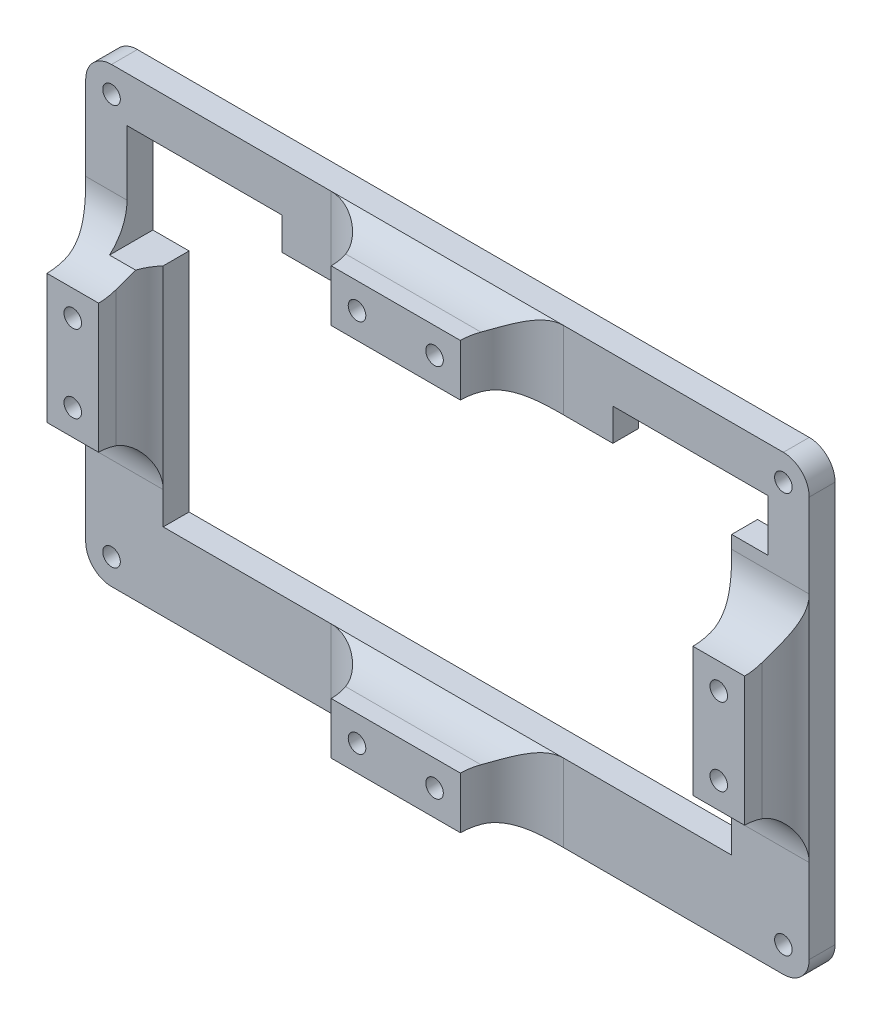
from build123d import *

# Parameters (mm, degrees)
SKETCH1_W            = 140
SKETCH1_H            = 87.5
SKETCH1_W_2          = 110
SKETCH1_H_2          = 57.5
BOSS_EXTRUDE1_DEPTH  = 5
M3_CLEARANCE_HOLE1_D = 3.4
SKETCH5_W            = 30
SKETCH5_H            = 20
SKETCH5_H_2          = 10
CUT_EXTRUDE1_DEPTH   = 5
FILLET1_R            = 5
SKETCH6_W            = 25
SKETCH6_H            = 10
SKETCH6_W_2          = 10
SKETCH6_H_2          = 25
BOSS_EXTRUDE2_DEPTH  = 10
SKETCH7_R            = 1.7
CUT_EXTRUDE2_DEPTH   = 84.899120973
SKETCH8_R            = 2.5
CUT_EXTRUDE3_DEPTH   = 10
FILLET2_R            = 10
FILLET3_START        = -70.000000131
FILLET3_DEPTH        = 15.000000131
FILLET3_2_DEPTH      = 8.000000131
FILLET3_START_2      = 12.5
FILLET3_3_DEPTH      = 10.5


with BuildPart() as part:
    # Sketch1 → Boss-Extrude1 (new body)
    with BuildSketch(Plane.XY):
        Rectangle(SKETCH1_W, SKETCH1_H)
        Rectangle(SKETCH1_W_2, SKETCH1_H_2, mode=Mode.SUBTRACT)
    extrude(amount=BOSS_EXTRUDE1_DEPTH)

    # M3 Clearance Hole1 (through all)
    with Locations(Plane.XY.offset(5)):
        with Locations((-65, 38.75), (65, 38.75), (65, -38.75), (-65, -38.75)):
            Hole(M3_CLEARANCE_HOLE1_D / 2)

    # Sketch5 → Cut-Extrude1 (cut)
    with BuildSketch(Plane.XY.offset(5)):
        with Locations((-47, 25)):
            Rectangle(SKETCH5_W, SKETCH5_H)
        with Locations((47, 30)):
            Rectangle(SKETCH5_W, SKETCH5_H_2)
    extrude(amount=-CUT_EXTRUDE1_DEPTH, mode=Mode.SUBTRACT)

    # Fillet1
    fillet1_edges = [part.edges().sort_by_distance(p)[0] for p in [
        (70, -43.75, 2.5),
        (-70, -43.75, 2.5),
        (-70, 43.75, 2.5),
        (70, 43.75, 2.5),
    ]]
    fillet(fillet1_edges, radius=FILLET1_R)

    # Sketch6 → Boss-Extrude2 (add)
    with BuildSketch(Plane.XY.offset(5)):
        with Locations((0, 36.25)):
            Rectangle(SKETCH6_W, SKETCH6_H)
        with Locations((62.5, 0)):
            Rectangle(SKETCH6_W_2, SKETCH6_H_2)
        with Locations((-62.5, 0)):
            Rectangle(SKETCH6_W_2, SKETCH6_H_2)
        with Locations((0, -36.25)):
            Rectangle(SKETCH6_W, SKETCH6_H)
    extrude(amount=BOSS_EXTRUDE2_DEPTH)

    # Sketch7 → Cut-Extrude2 (cut, through all)
    with BuildSketch(Plane(origin=(0, 0, 0), x_dir=(-1, 0, 0), z_dir=(0, 0, -1))):
        with Locations((-62.5, 7.5)):
            Circle(SKETCH7_R)
        with Locations((-62.5, -7.5)):
            Circle(SKETCH7_R)
        with Locations((7.5, 36.25)):
            Circle(SKETCH7_R)
        with Locations((-7.5, 36.25)):
            Circle(SKETCH7_R)
        with Locations((62.5, 7.5)):
            Circle(SKETCH7_R)
        with Locations((62.5, -7.5)):
            Circle(SKETCH7_R)
        with Locations((7.5, -36.25)):
            Circle(SKETCH7_R)
        with Locations((-7.5, -36.25)):
            Circle(SKETCH7_R)
    extrude(amount=-CUT_EXTRUDE2_DEPTH, mode=Mode.SUBTRACT)

    # Sketch8 → Cut-Extrude3 (cut)
    with BuildSketch(Plane(origin=(0, 0, 0), x_dir=(-1, 0, 0), z_dir=(0, 0, -1))):
        with Locations((7.5, 36.25)):
            Circle(SKETCH8_R)
        with Locations((-7.5, 36.25)):
            Circle(SKETCH8_R)
        with Locations((62.5, 7.5)):
            Circle(SKETCH8_R)
        with Locations((62.5, -7.5)):
            Circle(SKETCH8_R)
        with Locations((7.5, -36.25)):
            Circle(SKETCH8_R)
        with Locations((-7.5, -36.25)):
            Circle(SKETCH8_R)
        with Locations((-62.5, 7.5)):
            Circle(SKETCH8_R)
        with Locations((-62.5, -7.5)):
            Circle(SKETCH8_R)
    extrude(amount=-CUT_EXTRUDE3_DEPTH, mode=Mode.SUBTRACT)

    # Fillet2
    # the kernel refuses this fillet: 10 mm, written as the material it adds along each edge
    with BuildSketch(Plane(origin=(-57.5, -12.5, 5), x_dir=(1, 0, 0), z_dir=(0, 1, 0)), Plane(origin=(-67.5, 12.5, 5), x_dir=(-1, 0, 0), z_dir=(0, -1, 0)), Plane(origin=(57.5, 12.5, 5), x_dir=(-1, 0, 0), z_dir=(0, -1, 0)), Plane(origin=(67.5, -12.5, 5), x_dir=(1, 0, 0), z_dir=(0, 1, 0)), Plane(origin=(12.5, -31.25, 5), x_dir=(0, 1, 0), z_dir=(-1, 0, 0)), Plane(origin=(-12.5, -41.25, 5), x_dir=(0, -1, 0), z_dir=(1, 0, 0)), Plane(origin=(-12.5, 31.25, 5), x_dir=(0, -1, 0), z_dir=(1, 0, 0)), Plane(origin=(12.5, 41.25, 5), x_dir=(0, 1, 0), z_dir=(-1, 0, 0))) as fillet2_piece_1:
        with BuildLine():
            CenterArc((10, -6.614378278), FILLET2_R, 138.590377891, 41.409622109)
            Line((0, -6.614378278), (-0.2, -6.614378278))
            Line((-0.2, -6.614378278), (-0.2, 0))
            Line((-0.2, 0), (0, 0.2))
            ThreePointArc((0, 0.2), (1.25, 0.2), (2.35, 0.132287566))
            Line((2.35, 0.132287566), (2.5, 0))
        make_face()
    extrude(amount=25)
    with BuildSketch(Plane(origin=(-67.5, -12.5, 5), x_dir=(0, -1, 0), z_dir=(1, 0, 0)), Plane(origin=(67.5, 12.5, 5), x_dir=(0, 1, 0), z_dir=(-1, 0, 0)), Plane(origin=(57.5, -12.5, 5), x_dir=(0, -1, 0), z_dir=(1, 0, 0)), Plane(origin=(12.5, -41.25, 5), x_dir=(1, 0, 0), z_dir=(0, 1, 0)), Plane(origin=(-12.5, -31.25, 5), x_dir=(-1, 0, 0), z_dir=(0, -1, 0)), Plane(origin=(-12.5, 41.25, 5), x_dir=(-1, 0, 0), z_dir=(0, -1, 0)), Plane(origin=(12.5, 31.25, 5), x_dir=(1, 0, 0), z_dir=(0, 1, 0))) as fillet2_piece_2:
        with BuildLine():
            CenterArc((FILLET2_R, -FILLET2_R), FILLET2_R, 90, 90)
            Line((0, -FILLET2_R), (-FILLET2_R * 0.02, -FILLET2_R))
            Line((-FILLET2_R * 0.02, -FILLET2_R), (-FILLET2_R * 0.02, FILLET2_R * 0.02))
            Line((-FILLET2_R * 0.02, FILLET2_R * 0.02), (FILLET2_R, FILLET2_R * 0.02))
            Line((FILLET2_R, FILLET2_R * 0.02), (FILLET2_R, 0))
        make_face()
    extrude(amount=10)
    with BuildSketch(Plane(origin=(-67.5, -12.5, 5), x_dir=(0, -1, 0), z_dir=(1, 0, 0))) as fillet2_piece_3a_section:
        with BuildLine():
            CenterArc((FILLET2_R, -FILLET2_R), FILLET2_R, 90, 90)
            Line((0, -FILLET2_R), (-FILLET2_R * 0.02, -FILLET2_R))
            Line((-FILLET2_R * 0.02, -FILLET2_R), (-FILLET2_R * 0.02, FILLET2_R * 0.02))
            Line((-FILLET2_R * 0.02, FILLET2_R * 0.02), (FILLET2_R, FILLET2_R * 0.02))
            Line((FILLET2_R, FILLET2_R * 0.02), (FILLET2_R, 0))
        make_face()
    fillet2_piece_3a = extrude(amount=35, mode=Mode.PRIVATE)
    fillet2_piece_3a = split(fillet2_piece_3a, bisect_by=Plane(origin=(-55, -12.5, 5), z_dir=(-1, 0, 0)), keep=Keep.TOP, mode=Mode.PRIVATE)
    fillet2_piece_3a = split(fillet2_piece_3a, bisect_by=Plane(origin=(-57.5, -12.5, 5), z_dir=(1, 0, 0)), keep=Keep.TOP, mode=Mode.PRIVATE)
    with BuildSketch(Plane(origin=(-57.5, -29.035945694, 5), x_dir=(1, 0, 0), z_dir=(0, 1, 0))) as fillet2_piece_3b_section:
        with BuildLine():
            CenterArc((10, -6.614378278), FILLET2_R, 138.590377891, 41.409622109)
            Line((0, -6.614378278), (-0.2, -6.614378278))
            Line((-0.2, -6.614378278), (-0.2, 0))
            Line((-0.2, 0), (0, 0.2))
            ThreePointArc((0, 0.2), (1.25, 0.2), (2.35, 0.132287566))
            Line((2.35, 0.132287566), (2.5, 0))
        make_face()
    fillet2_piece_3b = extrude(amount=41.535945694, mode=Mode.PRIVATE)
    fillet2_piece_3b = split(fillet2_piece_3b, bisect_by=Plane(origin=(-57.5, -28.75, 5), z_dir=(0, 1, 0)), keep=Keep.TOP, mode=Mode.PRIVATE)
    fillet2_piece_3b = split(fillet2_piece_3b, bisect_by=Plane(origin=(-57.5, -12.5, 5), z_dir=(0, -1, 0)), keep=Keep.TOP, mode=Mode.PRIVATE)
    fillet2_piece_3 = fillet2_piece_3a & fillet2_piece_3b
    add(fillet2_piece_3)
    with BuildSketch(Plane(origin=(-92.5, -12.5, 5), x_dir=(0, -1, 0), z_dir=(1, 0, 0))) as fillet2_piece_4a_section:
        with BuildLine():
            CenterArc((FILLET2_R, -FILLET2_R), FILLET2_R, 90, 90)
            Line((0, -FILLET2_R), (-FILLET2_R * 0.02, -FILLET2_R))
            Line((-FILLET2_R * 0.02, -FILLET2_R), (-FILLET2_R * 0.02, FILLET2_R * 0.02))
            Line((-FILLET2_R * 0.02, FILLET2_R * 0.02), (FILLET2_R, FILLET2_R * 0.02))
            Line((FILLET2_R, FILLET2_R * 0.02), (FILLET2_R, 0))
        make_face()
    fillet2_piece_4a = extrude(amount=35, mode=Mode.PRIVATE)
    fillet2_piece_4a = split(fillet2_piece_4a, bisect_by=Plane(origin=(-70, -12.5, 5), z_dir=(1, 0, 0)), keep=Keep.TOP, mode=Mode.PRIVATE)
    fillet2_piece_4a = split(fillet2_piece_4a, bisect_by=Plane(origin=(-67.5, -12.5, 5), z_dir=(-1, 0, 0)), keep=Keep.TOP, mode=Mode.PRIVATE)
    with BuildSketch(Plane(origin=(-67.5, 12.5, 5), x_dir=(-1, 0, 0), z_dir=(0, -1, 0))) as fillet2_piece_4b_section:
        with BuildLine():
            CenterArc((10, -6.614378278), FILLET2_R, 138.590377891, 41.409622109)
            Line((0, -6.614378278), (-0.2, -6.614378278))
            Line((-0.2, -6.614378278), (-0.2, 0))
            Line((-0.2, 0), (0, 0.2))
            ThreePointArc((0, 0.2), (1.25, 0.2), (2.35, 0.132287566))
            Line((2.35, 0.132287566), (2.5, 0))
        make_face()
    fillet2_piece_4b = extrude(amount=41.535945694, mode=Mode.PRIVATE)
    fillet2_piece_4b = split(fillet2_piece_4b, bisect_by=Plane(origin=(-67.5, -12.5, 5), z_dir=(0, -1, 0)), keep=Keep.TOP, mode=Mode.PRIVATE)
    fillet2_piece_4 = fillet2_piece_4a & fillet2_piece_4b
    add(fillet2_piece_4)
    with BuildSketch(Plane(origin=(67.5, -12.5, 5), x_dir=(1, 0, 0), z_dir=(0, 1, 0))) as fillet2_piece_5a_section:
        with BuildLine():
            CenterArc((10, -6.614378278), FILLET2_R, 138.590377891, 41.409622109)
            Line((0, -6.614378278), (-0.2, -6.614378278))
            Line((-0.2, -6.614378278), (-0.2, 0))
            Line((-0.2, 0), (0, 0.2))
            ThreePointArc((0, 0.2), (1.25, 0.2), (2.35, 0.132287566))
            Line((2.35, 0.132287566), (2.5, 0))
        make_face()
    fillet2_piece_5a = extrude(amount=41.535945694, mode=Mode.PRIVATE)
    fillet2_piece_5a = split(fillet2_piece_5a, bisect_by=Plane(origin=(67.5, 12.5, 5), z_dir=(0, 1, 0)), keep=Keep.TOP, mode=Mode.PRIVATE)
    with BuildSketch(Plane(origin=(92.5, 12.5, 5), x_dir=(0, 1, 0), z_dir=(-1, 0, 0))) as fillet2_piece_5b_section:
        with BuildLine():
            CenterArc((FILLET2_R, -FILLET2_R), FILLET2_R, 90, 90)
            Line((0, -FILLET2_R), (-FILLET2_R * 0.02, -FILLET2_R))
            Line((-FILLET2_R * 0.02, -FILLET2_R), (-FILLET2_R * 0.02, FILLET2_R * 0.02))
            Line((-FILLET2_R * 0.02, FILLET2_R * 0.02), (FILLET2_R, FILLET2_R * 0.02))
            Line((FILLET2_R, FILLET2_R * 0.02), (FILLET2_R, 0))
        make_face()
    fillet2_piece_5b = extrude(amount=35, mode=Mode.PRIVATE)
    fillet2_piece_5b = split(fillet2_piece_5b, bisect_by=Plane(origin=(70, 12.5, 5), z_dir=(-1, 0, 0)), keep=Keep.TOP, mode=Mode.PRIVATE)
    fillet2_piece_5b = split(fillet2_piece_5b, bisect_by=Plane(origin=(67.5, 12.5, 5), z_dir=(1, 0, 0)), keep=Keep.TOP, mode=Mode.PRIVATE)
    fillet2_piece_5 = fillet2_piece_5a & fillet2_piece_5b
    add(fillet2_piece_5)
    with BuildSketch(Plane(origin=(67.5, 12.5, 5), x_dir=(0, 1, 0), z_dir=(-1, 0, 0))) as fillet2_piece_6a_section:
        with BuildLine():
            CenterArc((FILLET2_R, -FILLET2_R), FILLET2_R, 90, 90)
            Line((0, -FILLET2_R), (-FILLET2_R * 0.02, -FILLET2_R))
            Line((-FILLET2_R * 0.02, -FILLET2_R), (-FILLET2_R * 0.02, FILLET2_R * 0.02))
            Line((-FILLET2_R * 0.02, FILLET2_R * 0.02), (FILLET2_R, FILLET2_R * 0.02))
            Line((FILLET2_R, FILLET2_R * 0.02), (FILLET2_R, 0))
        make_face()
    fillet2_piece_6a = extrude(amount=35, mode=Mode.PRIVATE)
    fillet2_piece_6a = split(fillet2_piece_6a, bisect_by=Plane(origin=(55, 12.5, 5), z_dir=(1, 0, 0)), keep=Keep.TOP, mode=Mode.PRIVATE)
    fillet2_piece_6a = split(fillet2_piece_6a, bisect_by=Plane(origin=(57.5, 12.5, 5), z_dir=(-1, 0, 0)), keep=Keep.TOP, mode=Mode.PRIVATE)
    with BuildSketch(Plane(origin=(57.5, 29.035945694, 5), x_dir=(-1, 0, 0), z_dir=(0, -1, 0))) as fillet2_piece_6b_section:
        with BuildLine():
            CenterArc((10, -6.614378278), FILLET2_R, 138.590377891, 41.409622109)
            Line((0, -6.614378278), (-0.2, -6.614378278))
            Line((-0.2, -6.614378278), (-0.2, 0))
            Line((-0.2, 0), (0, 0.2))
            ThreePointArc((0, 0.2), (1.25, 0.2), (2.35, 0.132287566))
            Line((2.35, 0.132287566), (2.5, 0))
        make_face()
    fillet2_piece_6b = extrude(amount=41.535945694, mode=Mode.PRIVATE)
    fillet2_piece_6b = split(fillet2_piece_6b, bisect_by=Plane(origin=(57.5, 25, 5), z_dir=(0, -1, 0)), keep=Keep.TOP, mode=Mode.PRIVATE)
    fillet2_piece_6b = split(fillet2_piece_6b, bisect_by=Plane(origin=(57.5, 12.5, 5), z_dir=(0, 1, 0)), keep=Keep.TOP, mode=Mode.PRIVATE)
    fillet2_piece_6 = fillet2_piece_6a & fillet2_piece_6b
    add(fillet2_piece_6)
    with BuildSketch(Plane(origin=(32.5, -12.5, 5), x_dir=(0, -1, 0), z_dir=(1, 0, 0))) as fillet2_piece_7a_section:
        with BuildLine():
            CenterArc((FILLET2_R, -FILLET2_R), FILLET2_R, 90, 90)
            Line((0, -FILLET2_R), (-FILLET2_R * 0.02, -FILLET2_R))
            Line((-FILLET2_R * 0.02, -FILLET2_R), (-FILLET2_R * 0.02, FILLET2_R * 0.02))
            Line((-FILLET2_R * 0.02, FILLET2_R * 0.02), (FILLET2_R, FILLET2_R * 0.02))
            Line((FILLET2_R, FILLET2_R * 0.02), (FILLET2_R, 0))
        make_face()
    fillet2_piece_7a = extrude(amount=35, mode=Mode.PRIVATE)
    fillet2_piece_7a = split(fillet2_piece_7a, bisect_by=Plane(origin=(55, -12.5, 5), z_dir=(1, 0, 0)), keep=Keep.TOP, mode=Mode.PRIVATE)
    fillet2_piece_7a = split(fillet2_piece_7a, bisect_by=Plane(origin=(57.5, -12.5, 5), z_dir=(-1, 0, 0)), keep=Keep.TOP, mode=Mode.PRIVATE)
    with BuildSketch(Plane(origin=(57.5, 12.5, 5), x_dir=(-1, 0, 0), z_dir=(0, -1, 0))) as fillet2_piece_7b_section:
        with BuildLine():
            CenterArc((10, -6.614378278), FILLET2_R, 138.590377891, 41.409622109)
            Line((0, -6.614378278), (-0.2, -6.614378278))
            Line((-0.2, -6.614378278), (-0.2, 0))
            Line((-0.2, 0), (0, 0.2))
            ThreePointArc((0, 0.2), (1.25, 0.2), (2.35, 0.132287566))
            Line((2.35, 0.132287566), (2.5, 0))
        make_face()
    fillet2_piece_7b = extrude(amount=41.535945694, mode=Mode.PRIVATE)
    fillet2_piece_7b = split(fillet2_piece_7b, bisect_by=Plane(origin=(57.5, -28.75, 5), z_dir=(0, 1, 0)), keep=Keep.TOP, mode=Mode.PRIVATE)
    fillet2_piece_7b = split(fillet2_piece_7b, bisect_by=Plane(origin=(57.5, -12.5, 5), z_dir=(0, -1, 0)), keep=Keep.TOP, mode=Mode.PRIVATE)
    fillet2_piece_7 = fillet2_piece_7a & fillet2_piece_7b
    add(fillet2_piece_7)
    with BuildSketch(Plane(origin=(57.5, -12.5, 5), x_dir=(0, -1, 0), z_dir=(1, 0, 0))) as fillet2_piece_8a_section:
        with BuildLine():
            CenterArc((FILLET2_R, -FILLET2_R), FILLET2_R, 90, 90)
            Line((0, -FILLET2_R), (-FILLET2_R * 0.02, -FILLET2_R))
            Line((-FILLET2_R * 0.02, -FILLET2_R), (-FILLET2_R * 0.02, FILLET2_R * 0.02))
            Line((-FILLET2_R * 0.02, FILLET2_R * 0.02), (FILLET2_R, FILLET2_R * 0.02))
            Line((FILLET2_R, FILLET2_R * 0.02), (FILLET2_R, 0))
        make_face()
    fillet2_piece_8a = extrude(amount=35, mode=Mode.PRIVATE)
    fillet2_piece_8a = split(fillet2_piece_8a, bisect_by=Plane(origin=(70, -12.5, 5), z_dir=(-1, 0, 0)), keep=Keep.TOP, mode=Mode.PRIVATE)
    fillet2_piece_8a = split(fillet2_piece_8a, bisect_by=Plane(origin=(67.5, -12.5, 5), z_dir=(1, 0, 0)), keep=Keep.TOP, mode=Mode.PRIVATE)
    with BuildSketch(Plane(origin=(67.5, -29.035945694, 5), x_dir=(1, 0, 0), z_dir=(0, 1, 0))) as fillet2_piece_8b_section:
        with BuildLine():
            CenterArc((10, -6.614378278), FILLET2_R, 138.590377891, 41.409622109)
            Line((0, -6.614378278), (-0.2, -6.614378278))
            Line((-0.2, -6.614378278), (-0.2, 0))
            Line((-0.2, 0), (0, 0.2))
            ThreePointArc((0, 0.2), (1.25, 0.2), (2.35, 0.132287566))
            Line((2.35, 0.132287566), (2.5, 0))
        make_face()
    fillet2_piece_8b = extrude(amount=41.535945694, mode=Mode.PRIVATE)
    fillet2_piece_8b = split(fillet2_piece_8b, bisect_by=Plane(origin=(67.5, -12.5, 5), z_dir=(0, -1, 0)), keep=Keep.TOP, mode=Mode.PRIVATE)
    fillet2_piece_8 = fillet2_piece_8a & fillet2_piece_8b
    add(fillet2_piece_8)
    with BuildSketch(Plane(origin=(12.5, -41.25, 5), x_dir=(1, 0, 0), z_dir=(0, 1, 0))) as fillet2_piece_9a_section:
        with BuildLine():
            CenterArc((FILLET2_R, -FILLET2_R), FILLET2_R, 90, 90)
            Line((0, -FILLET2_R), (-FILLET2_R * 0.02, -FILLET2_R))
            Line((-FILLET2_R * 0.02, -FILLET2_R), (-FILLET2_R * 0.02, FILLET2_R * 0.02))
            Line((-FILLET2_R * 0.02, FILLET2_R * 0.02), (FILLET2_R, FILLET2_R * 0.02))
            Line((FILLET2_R, FILLET2_R * 0.02), (FILLET2_R, 0))
        make_face()
    fillet2_piece_9a = extrude(amount=35, mode=Mode.PRIVATE)
    fillet2_piece_9a = split(fillet2_piece_9a, bisect_by=Plane(origin=(12.5, -28.75, 5), z_dir=(0, -1, 0)), keep=Keep.TOP, mode=Mode.PRIVATE)
    fillet2_piece_9a = split(fillet2_piece_9a, bisect_by=Plane(origin=(12.5, -31.25, 5), z_dir=(0, 1, 0)), keep=Keep.TOP, mode=Mode.PRIVATE)
    with BuildSketch(Plane(origin=(29.035945694, -31.25, 5), x_dir=(0, 1, 0), z_dir=(-1, 0, 0))) as fillet2_piece_9b_section:
        with BuildLine():
            CenterArc((10, -6.614378278), FILLET2_R, 138.590377891, 41.409622109)
            Line((0, -6.614378278), (-0.2, -6.614378278))
            Line((-0.2, -6.614378278), (-0.2, 0))
            Line((-0.2, 0), (0, 0.2))
            ThreePointArc((0, 0.2), (1.25, 0.2), (2.35, 0.132287566))
            Line((2.35, 0.132287566), (2.5, 0))
        make_face()
    fillet2_piece_9b = extrude(amount=41.535945694, mode=Mode.PRIVATE)
    fillet2_piece_9b = split(fillet2_piece_9b, bisect_by=Plane(origin=(12.5, -31.25, 5), z_dir=(1, 0, 0)), keep=Keep.TOP, mode=Mode.PRIVATE)
    fillet2_piece_9 = fillet2_piece_9a & fillet2_piece_9b
    add(fillet2_piece_9)
    with BuildSketch(Plane(origin=(12.5, -31.25, 5), x_dir=(0, 1, 0), z_dir=(-1, 0, 0))) as fillet2_piece_10a_section:
        with BuildLine():
            CenterArc((10, -6.614378278), FILLET2_R, 138.590377891, 41.409622109)
            Line((0, -6.614378278), (-0.2, -6.614378278))
            Line((-0.2, -6.614378278), (-0.2, 0))
            Line((-0.2, 0), (0, 0.2))
            ThreePointArc((0, 0.2), (1.25, 0.2), (2.35, 0.132287566))
            Line((2.35, 0.132287566), (2.5, 0))
        make_face()
    fillet2_piece_10a = extrude(amount=41.535945694, mode=Mode.PRIVATE)
    fillet2_piece_10a = split(fillet2_piece_10a, bisect_by=Plane(origin=(-12.5, -31.25, 5), z_dir=(-1, 0, 0)), keep=Keep.TOP, mode=Mode.PRIVATE)
    with BuildSketch(Plane(origin=(-12.5, -6.25, 5), x_dir=(-1, 0, 0), z_dir=(0, -1, 0))) as fillet2_piece_10b_section:
        with BuildLine():
            CenterArc((FILLET2_R, -FILLET2_R), FILLET2_R, 90, 90)
            Line((0, -FILLET2_R), (-FILLET2_R * 0.02, -FILLET2_R))
            Line((-FILLET2_R * 0.02, -FILLET2_R), (-FILLET2_R * 0.02, FILLET2_R * 0.02))
            Line((-FILLET2_R * 0.02, FILLET2_R * 0.02), (FILLET2_R, FILLET2_R * 0.02))
            Line((FILLET2_R, FILLET2_R * 0.02), (FILLET2_R, 0))
        make_face()
    fillet2_piece_10b = extrude(amount=35, mode=Mode.PRIVATE)
    fillet2_piece_10b = split(fillet2_piece_10b, bisect_by=Plane(origin=(-12.5, -28.75, 5), z_dir=(0, -1, 0)), keep=Keep.TOP, mode=Mode.PRIVATE)
    fillet2_piece_10b = split(fillet2_piece_10b, bisect_by=Plane(origin=(-12.5, -31.25, 5), z_dir=(0, 1, 0)), keep=Keep.TOP, mode=Mode.PRIVATE)
    fillet2_piece_10 = fillet2_piece_10a & fillet2_piece_10b
    add(fillet2_piece_10)
    with BuildSketch(Plane(origin=(-12.5, -41.25, 5), x_dir=(0, -1, 0), z_dir=(1, 0, 0))) as fillet2_piece_11a_section:
        with BuildLine():
            CenterArc((10, -6.614378278), FILLET2_R, 138.590377891, 41.409622109)
            Line((0, -6.614378278), (-0.2, -6.614378278))
            Line((-0.2, -6.614378278), (-0.2, 0))
            Line((-0.2, 0), (0, 0.2))
            ThreePointArc((0, 0.2), (1.25, 0.2), (2.35, 0.132287566))
            Line((2.35, 0.132287566), (2.5, 0))
        make_face()
    fillet2_piece_11a = extrude(amount=41.535945694, mode=Mode.PRIVATE)
    fillet2_piece_11a = split(fillet2_piece_11a, bisect_by=Plane(origin=(12.5, -41.25, 5), z_dir=(1, 0, 0)), keep=Keep.TOP, mode=Mode.PRIVATE)
    with BuildSketch(Plane(origin=(12.5, -66.25, 5), x_dir=(1, 0, 0), z_dir=(0, 1, 0))) as fillet2_piece_11b_section:
        with BuildLine():
            CenterArc((FILLET2_R, -FILLET2_R), FILLET2_R, 90, 90)
            Line((0, -FILLET2_R), (-FILLET2_R * 0.02, -FILLET2_R))
            Line((-FILLET2_R * 0.02, -FILLET2_R), (-FILLET2_R * 0.02, FILLET2_R * 0.02))
            Line((-FILLET2_R * 0.02, FILLET2_R * 0.02), (FILLET2_R, FILLET2_R * 0.02))
            Line((FILLET2_R, FILLET2_R * 0.02), (FILLET2_R, 0))
        make_face()
    fillet2_piece_11b = extrude(amount=35, mode=Mode.PRIVATE)
    fillet2_piece_11b = split(fillet2_piece_11b, bisect_by=Plane(origin=(12.5, -43.75, 5), z_dir=(0, 1, 0)), keep=Keep.TOP, mode=Mode.PRIVATE)
    fillet2_piece_11b = split(fillet2_piece_11b, bisect_by=Plane(origin=(12.5, -41.25, 5), z_dir=(0, -1, 0)), keep=Keep.TOP, mode=Mode.PRIVATE)
    fillet2_piece_11 = fillet2_piece_11a & fillet2_piece_11b
    add(fillet2_piece_11)
    with BuildSketch(Plane(origin=(-29.035945694, -41.25, 5), x_dir=(0, -1, 0), z_dir=(1, 0, 0))) as fillet2_piece_12a_section:
        with BuildLine():
            CenterArc((10, -6.614378278), FILLET2_R, 138.590377891, 41.409622109)
            Line((0, -6.614378278), (-0.2, -6.614378278))
            Line((-0.2, -6.614378278), (-0.2, 0))
            Line((-0.2, 0), (0, 0.2))
            ThreePointArc((0, 0.2), (1.25, 0.2), (2.35, 0.132287566))
            Line((2.35, 0.132287566), (2.5, 0))
        make_face()
    fillet2_piece_12a = extrude(amount=41.535945694, mode=Mode.PRIVATE)
    fillet2_piece_12a = split(fillet2_piece_12a, bisect_by=Plane(origin=(-12.5, -41.25, 5), z_dir=(-1, 0, 0)), keep=Keep.TOP, mode=Mode.PRIVATE)
    with BuildSketch(Plane(origin=(-12.5, -31.25, 5), x_dir=(-1, 0, 0), z_dir=(0, -1, 0))) as fillet2_piece_12b_section:
        with BuildLine():
            CenterArc((FILLET2_R, -FILLET2_R), FILLET2_R, 90, 90)
            Line((0, -FILLET2_R), (-FILLET2_R * 0.02, -FILLET2_R))
            Line((-FILLET2_R * 0.02, -FILLET2_R), (-FILLET2_R * 0.02, FILLET2_R * 0.02))
            Line((-FILLET2_R * 0.02, FILLET2_R * 0.02), (FILLET2_R, FILLET2_R * 0.02))
            Line((FILLET2_R, FILLET2_R * 0.02), (FILLET2_R, 0))
        make_face()
    fillet2_piece_12b = extrude(amount=35, mode=Mode.PRIVATE)
    fillet2_piece_12b = split(fillet2_piece_12b, bisect_by=Plane(origin=(-12.5, -43.75, 5), z_dir=(0, 1, 0)), keep=Keep.TOP, mode=Mode.PRIVATE)
    fillet2_piece_12b = split(fillet2_piece_12b, bisect_by=Plane(origin=(-12.5, -41.25, 5), z_dir=(0, -1, 0)), keep=Keep.TOP, mode=Mode.PRIVATE)
    fillet2_piece_12 = fillet2_piece_12a & fillet2_piece_12b
    add(fillet2_piece_12)
    with BuildSketch(Plane(origin=(12.5, 41.25, 5), x_dir=(0, 1, 0), z_dir=(-1, 0, 0))) as fillet2_piece_13a_section:
        with BuildLine():
            CenterArc((10, -6.614378278), FILLET2_R, 138.590377891, 41.409622109)
            Line((0, -6.614378278), (-0.2, -6.614378278))
            Line((-0.2, -6.614378278), (-0.2, 0))
            Line((-0.2, 0), (0, 0.2))
            ThreePointArc((0, 0.2), (1.25, 0.2), (2.35, 0.132287566))
            Line((2.35, 0.132287566), (2.5, 0))
        make_face()
    fillet2_piece_13a = extrude(amount=41.535945694, mode=Mode.PRIVATE)
    fillet2_piece_13a = split(fillet2_piece_13a, bisect_by=Plane(origin=(-12.5, 41.25, 5), z_dir=(-1, 0, 0)), keep=Keep.TOP, mode=Mode.PRIVATE)
    with BuildSketch(Plane(origin=(-12.5, 66.25, 5), x_dir=(-1, 0, 0), z_dir=(0, -1, 0))) as fillet2_piece_13b_section:
        with BuildLine():
            CenterArc((FILLET2_R, -FILLET2_R), FILLET2_R, 90, 90)
            Line((0, -FILLET2_R), (-FILLET2_R * 0.02, -FILLET2_R))
            Line((-FILLET2_R * 0.02, -FILLET2_R), (-FILLET2_R * 0.02, FILLET2_R * 0.02))
            Line((-FILLET2_R * 0.02, FILLET2_R * 0.02), (FILLET2_R, FILLET2_R * 0.02))
            Line((FILLET2_R, FILLET2_R * 0.02), (FILLET2_R, 0))
        make_face()
    fillet2_piece_13b = extrude(amount=35, mode=Mode.PRIVATE)
    fillet2_piece_13b = split(fillet2_piece_13b, bisect_by=Plane(origin=(-12.5, 43.75, 5), z_dir=(0, -1, 0)), keep=Keep.TOP, mode=Mode.PRIVATE)
    fillet2_piece_13b = split(fillet2_piece_13b, bisect_by=Plane(origin=(-12.5, 41.25, 5), z_dir=(0, 1, 0)), keep=Keep.TOP, mode=Mode.PRIVATE)
    fillet2_piece_13 = fillet2_piece_13a & fillet2_piece_13b
    add(fillet2_piece_13)
    with BuildSketch(Plane(origin=(-29.035945694, 31.25, 5), x_dir=(0, -1, 0), z_dir=(1, 0, 0))) as fillet2_piece_14a_section:
        with BuildLine():
            CenterArc((10, -6.614378278), FILLET2_R, 138.590377891, 41.409622109)
            Line((0, -6.614378278), (-0.2, -6.614378278))
            Line((-0.2, -6.614378278), (-0.2, 0))
            Line((-0.2, 0), (0, 0.2))
            ThreePointArc((0, 0.2), (1.25, 0.2), (2.35, 0.132287566))
            Line((2.35, 0.132287566), (2.5, 0))
        make_face()
    fillet2_piece_14a = extrude(amount=41.535945694, mode=Mode.PRIVATE)
    fillet2_piece_14a = split(fillet2_piece_14a, bisect_by=Plane(origin=(-12.5, 31.25, 5), z_dir=(-1, 0, 0)), keep=Keep.TOP, mode=Mode.PRIVATE)
    with BuildSketch(Plane(origin=(-12.5, 41.25, 5), x_dir=(-1, 0, 0), z_dir=(0, -1, 0))) as fillet2_piece_14b_section:
        with BuildLine():
            CenterArc((FILLET2_R, -FILLET2_R), FILLET2_R, 90, 90)
            Line((0, -FILLET2_R), (-FILLET2_R * 0.02, -FILLET2_R))
            Line((-FILLET2_R * 0.02, -FILLET2_R), (-FILLET2_R * 0.02, FILLET2_R * 0.02))
            Line((-FILLET2_R * 0.02, FILLET2_R * 0.02), (FILLET2_R, FILLET2_R * 0.02))
            Line((FILLET2_R, FILLET2_R * 0.02), (FILLET2_R, 0))
        make_face()
    fillet2_piece_14b = extrude(amount=35, mode=Mode.PRIVATE)
    fillet2_piece_14b = split(fillet2_piece_14b, bisect_by=Plane(origin=(-12.5, 28.75, 5), z_dir=(0, 1, 0)), keep=Keep.TOP, mode=Mode.PRIVATE)
    fillet2_piece_14b = split(fillet2_piece_14b, bisect_by=Plane(origin=(-12.5, 31.25, 5), z_dir=(0, -1, 0)), keep=Keep.TOP, mode=Mode.PRIVATE)
    fillet2_piece_14 = fillet2_piece_14a & fillet2_piece_14b
    add(fillet2_piece_14)
    with BuildSketch(Plane(origin=(-12.5, 31.25, 5), x_dir=(0, -1, 0), z_dir=(1, 0, 0))) as fillet2_piece_15a_section:
        with BuildLine():
            CenterArc((10, -6.614378278), FILLET2_R, 138.590377891, 41.409622109)
            Line((0, -6.614378278), (-0.2, -6.614378278))
            Line((-0.2, -6.614378278), (-0.2, 0))
            Line((-0.2, 0), (0, 0.2))
            ThreePointArc((0, 0.2), (1.25, 0.2), (2.35, 0.132287566))
            Line((2.35, 0.132287566), (2.5, 0))
        make_face()
    fillet2_piece_15a = extrude(amount=41.535945694, mode=Mode.PRIVATE)
    fillet2_piece_15a = split(fillet2_piece_15a, bisect_by=Plane(origin=(12.5, 31.25, 5), z_dir=(1, 0, 0)), keep=Keep.TOP, mode=Mode.PRIVATE)
    with BuildSketch(Plane(origin=(12.5, 6.25, 5), x_dir=(1, 0, 0), z_dir=(0, 1, 0))) as fillet2_piece_15b_section:
        with BuildLine():
            CenterArc((FILLET2_R, -FILLET2_R), FILLET2_R, 90, 90)
            Line((0, -FILLET2_R), (-FILLET2_R * 0.02, -FILLET2_R))
            Line((-FILLET2_R * 0.02, -FILLET2_R), (-FILLET2_R * 0.02, FILLET2_R * 0.02))
            Line((-FILLET2_R * 0.02, FILLET2_R * 0.02), (FILLET2_R, FILLET2_R * 0.02))
            Line((FILLET2_R, FILLET2_R * 0.02), (FILLET2_R, 0))
        make_face()
    fillet2_piece_15b = extrude(amount=35, mode=Mode.PRIVATE)
    fillet2_piece_15b = split(fillet2_piece_15b, bisect_by=Plane(origin=(12.5, 28.75, 5), z_dir=(0, 1, 0)), keep=Keep.TOP, mode=Mode.PRIVATE)
    fillet2_piece_15b = split(fillet2_piece_15b, bisect_by=Plane(origin=(12.5, 31.25, 5), z_dir=(0, -1, 0)), keep=Keep.TOP, mode=Mode.PRIVATE)
    fillet2_piece_15 = fillet2_piece_15a & fillet2_piece_15b
    add(fillet2_piece_15)
    with BuildSketch(Plane(origin=(12.5, 31.25, 5), x_dir=(1, 0, 0), z_dir=(0, 1, 0))) as fillet2_piece_16a_section:
        with BuildLine():
            CenterArc((FILLET2_R, -FILLET2_R), FILLET2_R, 90, 90)
            Line((0, -FILLET2_R), (-FILLET2_R * 0.02, -FILLET2_R))
            Line((-FILLET2_R * 0.02, -FILLET2_R), (-FILLET2_R * 0.02, FILLET2_R * 0.02))
            Line((-FILLET2_R * 0.02, FILLET2_R * 0.02), (FILLET2_R, FILLET2_R * 0.02))
            Line((FILLET2_R, FILLET2_R * 0.02), (FILLET2_R, 0))
        make_face()
    fillet2_piece_16a = extrude(amount=35, mode=Mode.PRIVATE)
    fillet2_piece_16a = split(fillet2_piece_16a, bisect_by=Plane(origin=(12.5, 43.75, 5), z_dir=(0, -1, 0)), keep=Keep.TOP, mode=Mode.PRIVATE)
    fillet2_piece_16a = split(fillet2_piece_16a, bisect_by=Plane(origin=(12.5, 41.25, 5), z_dir=(0, 1, 0)), keep=Keep.TOP, mode=Mode.PRIVATE)
    with BuildSketch(Plane(origin=(29.035945694, 41.25, 5), x_dir=(0, 1, 0), z_dir=(-1, 0, 0))) as fillet2_piece_16b_section:
        with BuildLine():
            CenterArc((10, -6.614378278), FILLET2_R, 138.590377891, 41.409622109)
            Line((0, -6.614378278), (-0.2, -6.614378278))
            Line((-0.2, -6.614378278), (-0.2, 0))
            Line((-0.2, 0), (0, 0.2))
            ThreePointArc((0, 0.2), (1.25, 0.2), (2.35, 0.132287566))
            Line((2.35, 0.132287566), (2.5, 0))
        make_face()
    fillet2_piece_16b = extrude(amount=41.535945694, mode=Mode.PRIVATE)
    fillet2_piece_16b = split(fillet2_piece_16b, bisect_by=Plane(origin=(12.5, 41.25, 5), z_dir=(1, 0, 0)), keep=Keep.TOP, mode=Mode.PRIVATE)
    fillet2_piece_16 = fillet2_piece_16a & fillet2_piece_16b
    add(fillet2_piece_16)

    # Fillet3: read off the stored shape, not the designer's step
    # Fillet3 outline → Fillet3 (add)
    with BuildSketch(Plane.YZ.offset(FILLET3_START)):
        with BuildLine():
            Line((15, 5), (15, 8.385621722))
            ThreePointArc((15, 8.385621722), (13.145856533, 11.464466094), (12.5, 15))
            Line((12.5, 15), (12.5, 5))
            Line((12.5, 5), (15, 5))
        make_face()
    extrude(amount=FILLET3_DEPTH)

    # Fillet3 2 outline → Fillet3 2 (add)
    with BuildSketch(Plane.YZ.offset(FILLET3_START)):
        with BuildLine():
            ThreePointArc((22.5, 5), (18.385621722, 5.885621722), (15, 8.385621722))
            Line((15, 8.385621722), (15, 5))
            Line((15, 5), (22.5, 5))
        make_face()
    extrude(amount=FILLET3_2_DEPTH)

    # Fillet3 3 outline → Fillet3 3 (cut)
    with BuildSketch(Plane(origin=(0, 0, 0), x_dir=(1, 0, 0), z_dir=(0, 1, 0)).offset(FILLET3_START_2)):
        with BuildLine():
            Line((-70, -5), (-70.000000131, -15))
            Line((-70.000000131, -15), (-67.5, -15))
            Line((-67.5, -15), (-67.5, -11.614378278))
            ThreePointArc((-67.5, -11.614378278), (-68.145856533, -8.078844372), (-70, -5))
        make_face()
        with BuildLine():
            Line((-57.5, -11.614378278), (-57.5, -15))
            Line((-57.5, -15), (-55, -15))
            Line((-55, -15), (-55, -5))
            ThreePointArc((-55, -5), (-56.854143467, -8.078844372), (-57.5, -11.614378278))
        make_face()
    extrude(amount=FILLET3_3_DEPTH, mode=Mode.SUBTRACT)


solid = part.part
